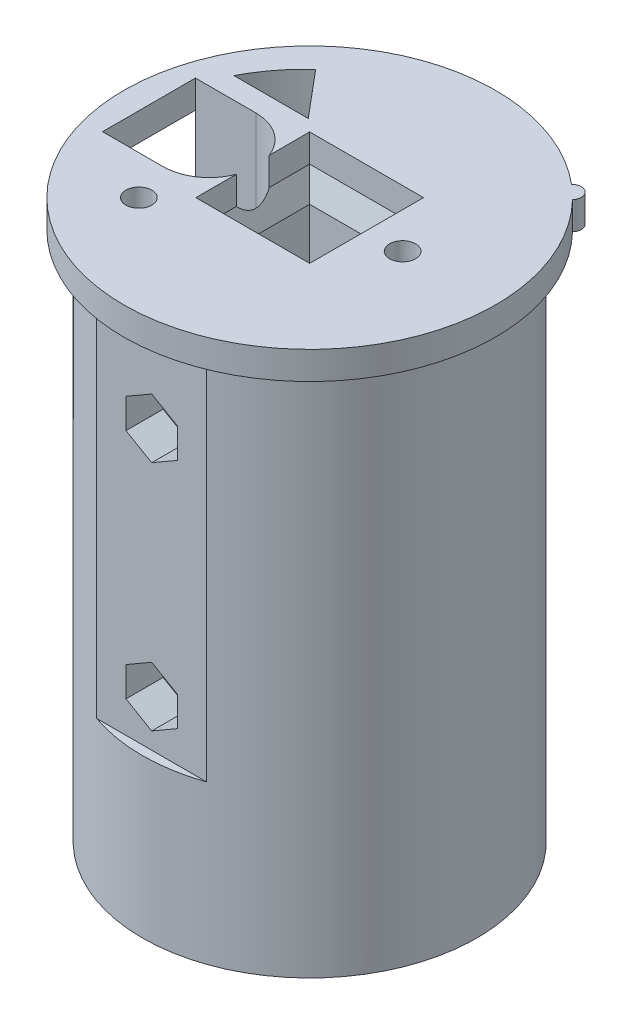
from build123d import *

# Parameters (mm, degrees)
SKETCH1_R           = 18
SKETCH1_R_2         = 2
SKETCH1_W           = 10.25
SKETCH1_H           = 10.25
BOSS_EXTRUDE1_DEPTH = 57
CUT_EXTRUDE1_START  = -25
CUT_EXTRUDE1_DEPTH  = 25
SKETCH4_W           = 9.35
SKETCH4_H           = 9.35
CUT_EXTRUDE3_DEPTH  = 20.4
CUT_EXTRUDE4_START  = -40
CUT_EXTRUDE4_DEPTH  = 40
SKETCH6_R           = 1.5
CUT_EXTRUDE5_DEPTH  = 70.267597042
SKETCH7_R           = 3
CUT_EXTRUDE6_DEPTH  = 3
CUT_EXTRUDE7_DEPTH  = 4
CHAMFER1_SIZE       = 1
CHAMFER1_SIZE_2     = 2.747477419
CUT_EXTRUDE8_DEPTH  = 63.42595614
SKETCH12_R          = 1.4
CUT_EXTRUDE10_DEPTH = 20
SKETCH13_R          = 20
SKETCH13_R_2        = 1.4
BOSS_EXTRUDE2_DEPTH = 3
BOSS_EXTRUDE3_DEPTH = 3


with BuildPart() as part:
    # Sketch1 → Boss-Extrude1 (new body)
    with BuildSketch(Plane(origin=(0, 0, 0), x_dir=(1, 0, 0), z_dir=(0, 1, 0))):
        with Locations(Location((0, 0, 0), (0, 0, 90))):
            Circle(SKETCH1_R)
        with Locations(Location((-12, 0, 0), (0, 0, 90))):
            Circle(SKETCH1_R_2, mode=Mode.SUBTRACT)
        Rectangle(SKETCH1_W, SKETCH1_H, mode=Mode.SUBTRACT)
    extrude(amount=BOSS_EXTRUDE1_DEPTH)

    # Sketch2 → Cut-Extrude1 (cut)
    with BuildSketch(Plane(origin=(0, 57, 0), x_dir=(1, 0, 0), z_dir=(0, 1, 0)).offset(CUT_EXTRUDE1_START)):
        with BuildLine():
            Line((-10.8, 5), (-17.291616466, 5))
            ThreePointArc((-17.291616466, 5), (-18, 0), (-17.291616466, -5))
            Line((-17.291616466, -5), (-10.8, -5))
            ThreePointArc((-10.8, -5), (-5.8, 0), (-10.8, 5))
        make_face()
    extrude(amount=CUT_EXTRUDE1_DEPTH, mode=Mode.SUBTRACT)

    # Sketch4 → Cut-Extrude3 (cut)
    with BuildSketch(Plane(origin=(0, 0, 0), x_dir=(-1, 0, 0), z_dir=(0, -1, 0))):
        with Locations((11.135393506, 0.872889968)):
            Rectangle(SKETCH4_W, SKETCH4_H)
    extrude(amount=-CUT_EXTRUDE3_DEPTH, mode=Mode.SUBTRACT)

    # Sketch5 → Cut-Extrude4 (cut)
    with BuildSketch(Plane(origin=(0, 57, 0), x_dir=(1, 0, 0), z_dir=(0, 1, 0)).offset(CUT_EXTRUDE4_START)):
        with BuildLine():
            Line((5.916079783, 17), (-5.916079783, 17))
            ThreePointArc((-5.916079783, 17), (0, 18), (5.916079783, 17))
        make_face()
        with BuildLine():
            Line((5.916079783, -17), (-5.916079783, -17))
            ThreePointArc((-5.916079783, -17), (0, -18), (5.916079783, -17))
        make_face()
    extrude(amount=CUT_EXTRUDE4_DEPTH, mode=Mode.SUBTRACT)

    # Sketch6 → Cut-Extrude5 (cut, through all)
    with BuildSketch(Plane(origin=(0, 0, -17), x_dir=(-1, 0, 0), z_dir=(0, 0, -1))):
        with Locations((0, 47)):
            Circle(SKETCH6_R)
        with Locations((0, 22)):
            Circle(SKETCH6_R)
    extrude(amount=-CUT_EXTRUDE5_DEPTH, mode=Mode.SUBTRACT)

    # Sketch7 → Cut-Extrude6 (cut)
    with BuildSketch(Plane(origin=(0, 0, -17), x_dir=(-1, 0, 0), z_dir=(0, 0, -1))):
        with Locations((0, 47)):
            Circle(SKETCH7_R)
        with Locations((0, 22)):
            Circle(SKETCH7_R)
    extrude(amount=-CUT_EXTRUDE6_DEPTH, mode=Mode.SUBTRACT)

    # Sketch8 → Cut-Extrude7 (cut)
    with BuildSketch(Plane.XY.offset(17)):
        Polygon((0, 43.8), (2.771281292, 45.4), (2.771281292, 48.6), (0, 50.2), (-2.771281292, 48.6), (-2.771281292, 45.4), align=None)
        Polygon((0, 18.8), (2.771281292, 20.4), (2.771281292, 23.6), (0, 25.2), (-2.771281292, 23.6), (-2.771281292, 20.4), align=None)
    extrude(amount=-CUT_EXTRUDE7_DEPTH, mode=Mode.SUBTRACT)

    # Chamfer1
    # the kernel refuses this chamfer: 2.747477419, 1 mm, written as the material it takes off along each edge
    with BuildSketch(Plane(origin=(-5.125, 57, -5.125), x_dir=(0, 0.09904090225204956, -0.9950833631817488), z_dir=(1, 0, 0)), Plane(origin=(-5.125, 57, 5.125), x_dir=(-0.9950833631817488, 0.09904090225204956, 0), z_dir=(0, 0, -1)), Plane(origin=(5.125, 57, 5.125), x_dir=(0, 0.09904090225204956, 0.9950833631817488), z_dir=(-1, 0, 0)), Plane(origin=(5.125, 57, -5.125), x_dir=(0.9950833631817488, 0.09904090225204956, 0), z_dir=(0, 0, 1))) as chamfer1_piece_1:
        Polygon((CHAMFER1_SIZE * 0.995083363182, -CHAMFER1_SIZE * 0.099040902252), (-CHAMFER1_SIZE_2 * 0.0990409022684, -CHAMFER1_SIZE_2 * 0.995083363346), (0, 0), align=None)
    extrude(amount=10.25, mode=Mode.SUBTRACT)
    with BuildSketch(Plane(origin=(-5.125, 57, 5.125), x_dir=(-0.9950833631817488, 0.09904090225204956, 0), z_dir=(0, 0, -1))) as chamfer1_piece_2a_section:
        Polygon((CHAMFER1_SIZE * 0.995083363182, -CHAMFER1_SIZE * 0.099040902252), (-CHAMFER1_SIZE_2 * 0.0990409022684, -CHAMFER1_SIZE_2 * 0.995083363346), (0, 0), align=None)
    chamfer1_piece_2a = extrude(amount=17.377491449, mode=Mode.PRIVATE)
    chamfer1_piece_2a = split(chamfer1_piece_2a, bisect_by=Plane(origin=(-5.432505006, 56.059901151, -5.125), z_dir=(0, 0, -1)), keep=Keep.TOP, mode=Mode.PRIVATE)
    with BuildSketch(Plane(origin=(-12.252491449, 57, -5.125), x_dir=(0, 0.09904090225204956, -0.9950833631817488), z_dir=(1, 0, 0))) as chamfer1_piece_2b_section:
        Polygon((CHAMFER1_SIZE * 0.995083363182, -CHAMFER1_SIZE * 0.099040902252), (-CHAMFER1_SIZE_2 * 0.0990409022684, -CHAMFER1_SIZE_2 * 0.995083363346), (0, 0), align=None)
    chamfer1_piece_2b = extrude(amount=17.377491449, mode=Mode.PRIVATE)
    chamfer1_piece_2b = split(chamfer1_piece_2b, bisect_by=Plane(origin=(-5.125, 56.059901151, -5.432505006), z_dir=(-1, 0, 0)), keep=Keep.TOP, mode=Mode.PRIVATE)
    chamfer1_piece_2 = chamfer1_piece_2a & chamfer1_piece_2b
    add(chamfer1_piece_2, mode=Mode.SUBTRACT)
    with BuildSketch(Plane(origin=(5.125, 57, -12.252491449), x_dir=(0.9950833631817488, 0.09904090225204956, 0), z_dir=(0, 0, 1))) as chamfer1_piece_3a_section:
        Polygon((CHAMFER1_SIZE * 0.995083363182, -CHAMFER1_SIZE * 0.099040902252), (-CHAMFER1_SIZE_2 * 0.0990409022684, -CHAMFER1_SIZE_2 * 0.995083363346), (0, 0), align=None)
    chamfer1_piece_3a = extrude(amount=17.377491449, mode=Mode.PRIVATE)
    chamfer1_piece_3a = split(chamfer1_piece_3a, bisect_by=Plane(origin=(5.432505006, 56.059901151, -5.125), z_dir=(0, 0, -1)), keep=Keep.TOP, mode=Mode.PRIVATE)
    with BuildSketch(Plane(origin=(-5.125, 57, -5.125), x_dir=(0, 0.09904090225204956, -0.9950833631817488), z_dir=(1, 0, 0))) as chamfer1_piece_3b_section:
        Polygon((CHAMFER1_SIZE * 0.995083363182, -CHAMFER1_SIZE * 0.099040902252), (-CHAMFER1_SIZE_2 * 0.0990409022684, -CHAMFER1_SIZE_2 * 0.995083363346), (0, 0), align=None)
    chamfer1_piece_3b = extrude(amount=17.377491449, mode=Mode.PRIVATE)
    chamfer1_piece_3b = split(chamfer1_piece_3b, bisect_by=Plane(origin=(5.125, 56.059901151, -5.432505006), z_dir=(1, 0, 0)), keep=Keep.TOP, mode=Mode.PRIVATE)
    chamfer1_piece_3 = chamfer1_piece_3a & chamfer1_piece_3b
    add(chamfer1_piece_3, mode=Mode.SUBTRACT)
    with BuildSketch(Plane(origin=(5.125, 57, 5.125), x_dir=(0, 0.09904090225204956, 0.9950833631817488), z_dir=(-1, 0, 0))) as chamfer1_piece_4a_section:
        Polygon((CHAMFER1_SIZE * 0.995083363182, -CHAMFER1_SIZE * 0.099040902252), (-CHAMFER1_SIZE_2 * 0.0990409022684, -CHAMFER1_SIZE_2 * 0.995083363346), (0, 0), align=None)
    chamfer1_piece_4a = extrude(amount=17.377491449, mode=Mode.PRIVATE)
    chamfer1_piece_4a = split(chamfer1_piece_4a, bisect_by=Plane(origin=(-5.125, 56.059901151, 5.432505006), z_dir=(-1, 0, 0)), keep=Keep.TOP, mode=Mode.PRIVATE)
    with BuildSketch(Plane(origin=(-5.125, 57, 12.252491449), x_dir=(-0.9950833631817488, 0.09904090225204956, 0), z_dir=(0, 0, -1))) as chamfer1_piece_4b_section:
        Polygon((CHAMFER1_SIZE * 0.995083363182, -CHAMFER1_SIZE * 0.099040902252), (-CHAMFER1_SIZE_2 * 0.0990409022684, -CHAMFER1_SIZE_2 * 0.995083363346), (0, 0), align=None)
    chamfer1_piece_4b = extrude(amount=17.377491449, mode=Mode.PRIVATE)
    chamfer1_piece_4b = split(chamfer1_piece_4b, bisect_by=Plane(origin=(-5.432505006, 56.059901151, 5.125), z_dir=(0, 0, 1)), keep=Keep.TOP, mode=Mode.PRIVATE)
    chamfer1_piece_4 = chamfer1_piece_4a & chamfer1_piece_4b
    add(chamfer1_piece_4, mode=Mode.SUBTRACT)
    with BuildSketch(Plane(origin=(12.252491449, 57, 5.125), x_dir=(0, 0.09904090225204956, 0.9950833631817488), z_dir=(-1, 0, 0))) as chamfer1_piece_5a_section:
        Polygon((CHAMFER1_SIZE * 0.995083363182, -CHAMFER1_SIZE * 0.099040902252), (-CHAMFER1_SIZE_2 * 0.0990409022684, -CHAMFER1_SIZE_2 * 0.995083363346), (0, 0), align=None)
    chamfer1_piece_5a = extrude(amount=17.377491449, mode=Mode.PRIVATE)
    chamfer1_piece_5a = split(chamfer1_piece_5a, bisect_by=Plane(origin=(5.125, 56.059901151, 5.432505006), z_dir=(1, 0, 0)), keep=Keep.TOP, mode=Mode.PRIVATE)
    with BuildSketch(Plane(origin=(5.125, 57, -5.125), x_dir=(0.9950833631817488, 0.09904090225204956, 0), z_dir=(0, 0, 1))) as chamfer1_piece_5b_section:
        Polygon((CHAMFER1_SIZE * 0.995083363182, -CHAMFER1_SIZE * 0.099040902252), (-CHAMFER1_SIZE_2 * 0.0990409022684, -CHAMFER1_SIZE_2 * 0.995083363346), (0, 0), align=None)
    chamfer1_piece_5b = extrude(amount=17.377491449, mode=Mode.PRIVATE)
    chamfer1_piece_5b = split(chamfer1_piece_5b, bisect_by=Plane(origin=(5.432505006, 56.059901151, 5.125), z_dir=(0, 0, 1)), keep=Keep.TOP, mode=Mode.PRIVATE)
    chamfer1_piece_5 = chamfer1_piece_5a & chamfer1_piece_5b
    add(chamfer1_piece_5, mode=Mode.SUBTRACT)

    # Sketch9 → Cut-Extrude8 (cut, through all)
    with BuildSketch(Plane.XZ):
        with BuildLine():
            Line((-7.454203172, -7.297889968), (-15.454203172, -7.297889968))
            ThreePointArc((-15.454203172, -7.297889968), (-13.761984914, -9.955415688), (-11.632322635, -12.277178848))
            Line((-11.632322635, -12.277178848), (-7.454203172, -7.297889968))
        make_face()
    extrude(amount=-CUT_EXTRUDE8_DEPTH, mode=Mode.SUBTRACT)

    # Sketch12 → Cut-Extrude10 (cut)
    with BuildSketch(Plane(origin=(0, 57, 0), x_dir=(1, 0, 0), z_dir=(0, 1, 0))):
        with Locations(Location((10, 0, 0), (0, 0, 270))):
            Circle(SKETCH12_R)
        with Locations(Location((-9.192388155, -9.192388155, 0), (0, 0, 270))):
            Circle(SKETCH12_R)
    extrude(amount=-CUT_EXTRUDE10_DEPTH, mode=Mode.SUBTRACT)

    # Sketch13 → Boss-Extrude2 (add)
    with BuildSketch(Plane(origin=(0, 57, 0), x_dir=(1, 0, 0), z_dir=(0, 1, 0))):
        with Locations(Location((0, 0, 0), (0, 0, 270))):
            Circle(SKETCH13_R)
        with Locations(Location((10, 0, 0), (0, 0, 270))):
            Circle(SKETCH13_R_2, mode=Mode.SUBTRACT)
        with Locations(Location((-9.192388155, -9.192388155, 0), (0, 0, 270))):
            Circle(SKETCH13_R_2, mode=Mode.SUBTRACT)
        with BuildLine():
            Line((-10.8, 5), (-17.291616466, 5))
            Line((-17.291616466, 5), (-17.291616466, -5))
            Line((-17.291616466, -5), (-10.8, -5))
            ThreePointArc((-10.8, -5), (-7.959770503, -4.114984375), (-6.125, -1.773238563))
            Line((-6.125, -1.773238563), (-6.125, -6.125))
            Line((-6.125, -6.125), (6.125, -6.125))
            Line((6.125, -6.125), (6.125, 6.125))
            Line((6.125, 6.125), (-6.125, 6.125))
            Line((-6.125, 6.125), (-6.125, 1.773238563))
            ThreePointArc((-6.125, 1.773238563), (-7.959770503, 4.114984375), (-10.8, 5))
        make_face(mode=Mode.SUBTRACT)
        with BuildLine():
            Line((-7.454203172, 7.297889968), (-15.454203172, 7.297889968))
            ThreePointArc((-15.454203172, 7.297889968), (-13.761984914, 9.955415688), (-11.632322635, 12.277178848))
            Line((-11.632322635, 12.277178848), (-7.454203172, 7.297889968))
        make_face(mode=Mode.SUBTRACT)
    extrude(amount=BOSS_EXTRUDE2_DEPTH)

    # Sketch14 → Boss-Extrude3 (add)
    with BuildSketch(Plane(origin=(0, 60, 0), x_dir=(1, 0, 0), z_dir=(0, 1, 0))):
        with BuildLine():
            Line((12.855752194, 15.320888862), (14.321646009, 13.960317173))
            ThreePointArc((14.321646009, 13.960317173), (14.268984946, 15.373549926), (12.855752194, 15.320888862))
        make_face()
    extrude(amount=-BOSS_EXTRUDE3_DEPTH)


solid = part.part
